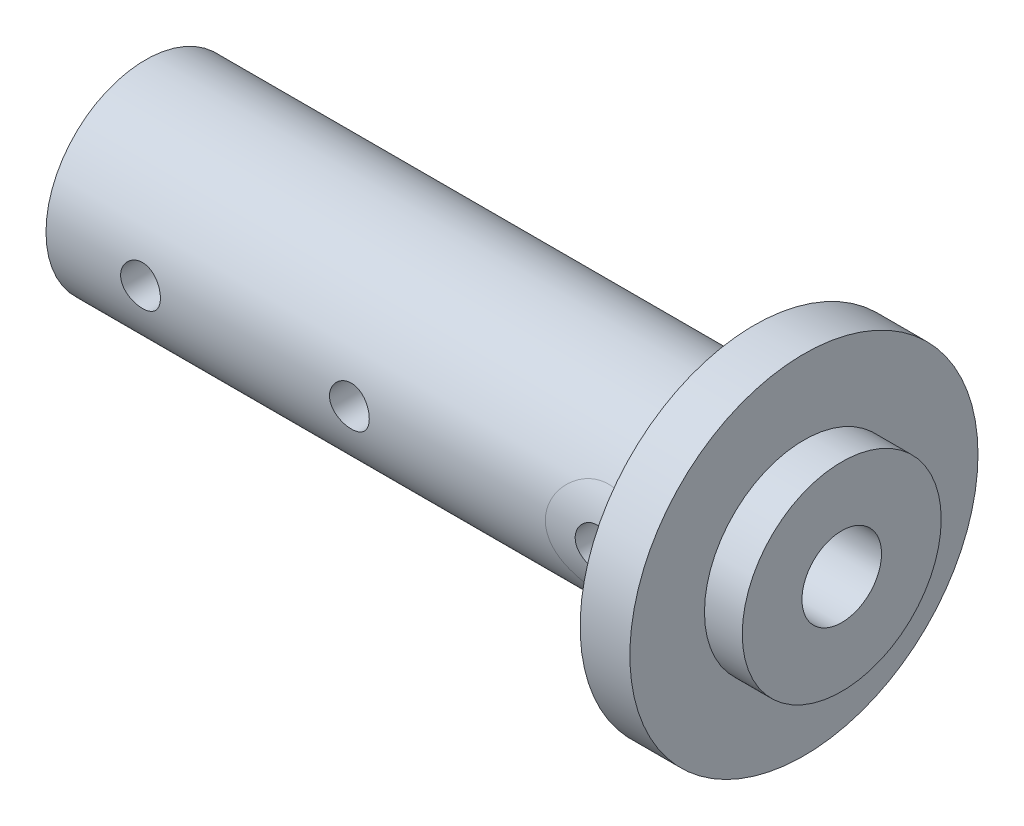
from build123d import *

# Parameters (mm, degrees)
CUT_EXTRUDE2_DEPTH      = 75.246212025
CUT_EXTRUDE2_DEPTH_BACK = 75.246212025
SKETCH5_R               = 2


with BuildPart() as part:
    # Sketch1 → Revolve2 (revolve)
    with BuildSketch(Plane(origin=(0, 0, 0), x_dir=(1, 0, 0), z_dir=(0, 1, 0))):
        Polygon((-3.8, 10), (-3.8, 17.5), (-8.8, 17.5), (-8.8, 10), (-70, 10), (-70, 4), (0, 4), (0, 10), align=None)
    revolve(axis=Axis((0, 0, 0), (-1, 0, 0)))

    # Sketch5 → Cut-Extrude2 (cut, two sides: drawn at the far end of the back side and taken through both)
    with BuildSketch(Plane.XY.offset(-CUT_EXTRUDE2_DEPTH_BACK)):
        with Locations((-39.5, 0)):
            Circle(SKETCH5_R)
        with Locations((-60.5, 0)):
            Circle(SKETCH5_R)
        with Locations((-14.8, 0)):
            Circle(SKETCH5_R)
    extrude(amount=CUT_EXTRUDE2_DEPTH + CUT_EXTRUDE2_DEPTH_BACK, mode=Mode.SUBTRACT)


solid = part.part
